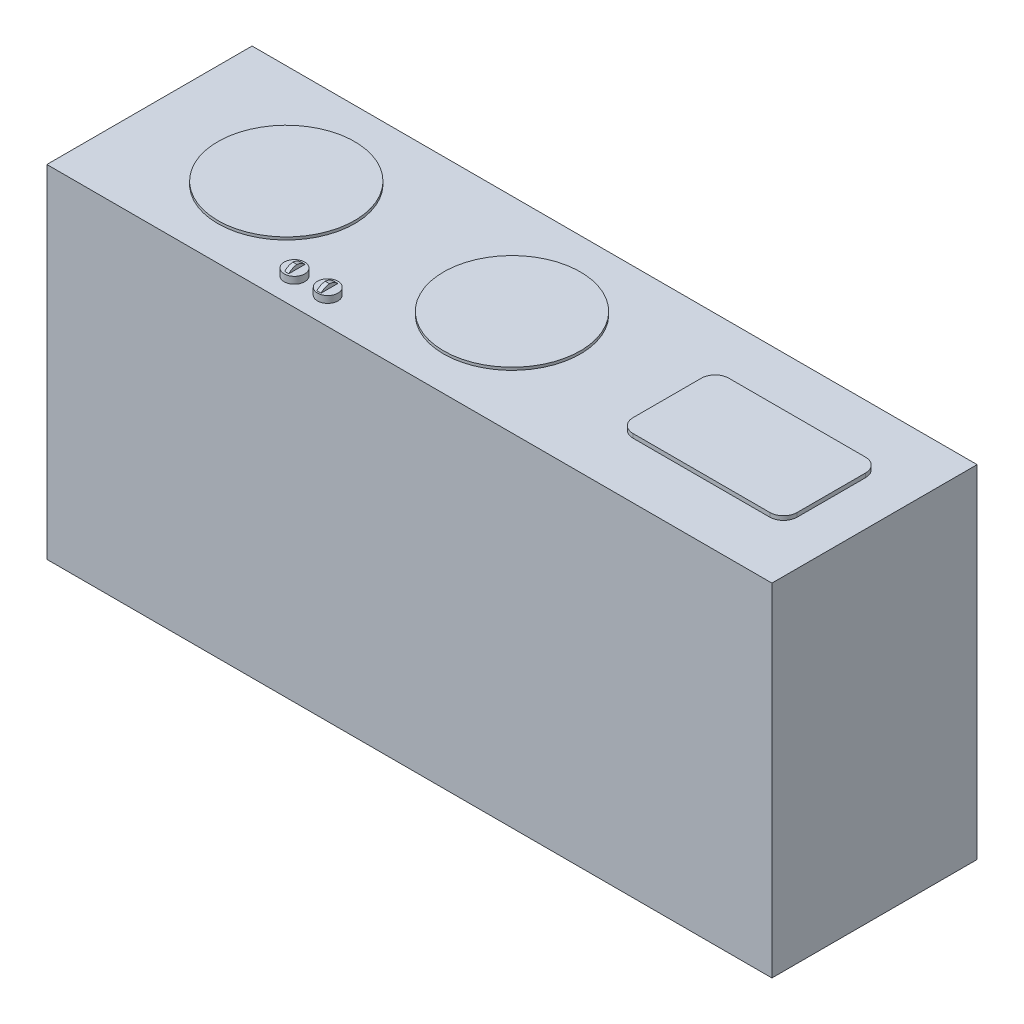
from build123d import *

# Parameters (mm, degrees)
SKETCH_1_W      = 53
SKETCH_1_H      = 15
EXTRUDE_1_DEPTH = 25
SKETCH_2_R      = 5
EXTRUDE_2_DEPTH = 0.2
SKETCH_3_R      = 0.75
EXTRUDE_4_DEPTH = 0.5
SKETCH_4_W      = 0.308010804
SKETCH_4_H      = 1.227700604
EXTRUDE_5_DEPTH = 0.3
SKETCH_6_W      = 0.300930155
SKETCH_6_H      = 1.191236652
EXTRUDE_8_DEPTH = 0.3
SKETCH_8_W      = 12
SKETCH_8_H      = 7
EXTRUDE_9_DEPTH = 0.3
FILLET_1_R      = 1
FILLET_2_R      = 1


with BuildPart() as part:
    # 草圖1 → 填料-伸長1 (new body)
    with BuildSketch(Plane(origin=(0, 0, 0), x_dir=(1, 0, 0), z_dir=(0, 1, 0))):
        Rectangle(SKETCH_1_W, SKETCH_1_H)
    extrude(amount=EXTRUDE_1_DEPTH)

    # 草圖2 → 填料-伸長2 (add)
    with BuildSketch(Plane(origin=(0, 25, 0), x_dir=(1, 0, 0), z_dir=(0, 1, 0))):
        with Locations(Location((0, 0, 0), (0, 0, 270))):
            Circle(SKETCH_2_R)
        with Locations(Location((-16.5, 0, 0), (0, 0, 270))):
            Circle(SKETCH_2_R)
    extrude(amount=EXTRUDE_2_DEPTH)

    # 草圖3 → 填料-伸長4 (add)
    with BuildSketch(Plane(origin=(0, 25, 0), x_dir=(1, 0, 0), z_dir=(0, 1, 0))):
        with Locations(Location((-7.968179653, -5.500848642, 0), (0, 0, 270))):
            Circle(SKETCH_3_R)
        with Locations(Location((-10.399702952, -5.500848642, 0), (0, 0, 270))):
            Circle(SKETCH_3_R)
    extrude(amount=EXTRUDE_4_DEPTH)

    # 草圖4 → 填料-伸長5 (add)
    with BuildSketch(Plane(origin=(0, 25.5, 0), x_dir=(1, 0, 0), z_dir=(0, 1, 0))):
        with Locations((-7.986543435, -5.513019863)):
            Rectangle(SKETCH_4_W, SKETCH_4_H)
    extrude(amount=EXTRUDE_5_DEPTH)

    # 草圖6 → 填料-伸長8 (add)
    with BuildSketch(Plane(origin=(0, 25.5, 0), x_dir=(1, 0, 0), z_dir=(0, 1, 0))):
        with Locations((-10.389863122, -5.481431278)):
            Rectangle(SKETCH_6_W, SKETCH_6_H)
    extrude(amount=EXTRUDE_8_DEPTH)

    # 草圖8 → 填料-伸長9 (add)
    with BuildSketch(Plane(origin=(0, 25, 0), x_dir=(1, 0, 0), z_dir=(0, 1, 0))):
        with Locations((17.250728111, 0.094744835)):
            Rectangle(SKETCH_8_W, SKETCH_8_H)
    extrude(amount=EXTRUDE_9_DEPTH)

    # 圓角1
    fillet_1_edges = [part.edges().sort_by_distance(p)[0] for p in [
        (23.250728111, 25.15, 3.405255165),
        (23.250728111, 25.15, -3.594744835),
        (11.250728111, 25.15, -3.594744835),
        (11.250728111, 25.15, 3.405255165),
    ]]
    fillet(fillet_1_edges, radius=FILLET_1_R)

    # 圓角2
    # the kernel refuses this fillet: 1 mm, written as the material it takes off along each edge
    with BuildSketch(Plane(origin=(-8.454040937, 25.8, 4.885812952), x_dir=(0, -1, 0), z_dir=(-1, 0, 0)), Plane(origin=(-12.325685306, 25.8, 6.077049604), x_dir=(0, -1, 0), z_dir=(1, 0, 0))) as fillet_2_piece_1:
        with BuildLine():
            CenterArc((1, 0.714142843), FILLET_2_R, 180, 45.572995999)
            Line((0, 0.714142843), (-0.02, 0.714142843))
            Line((-0.02, 0.714142843), (-0.02, 0))
            Line((-0.02, 0), (0, -0.02))
            ThreePointArc((0, -0.02), (0.15, -0.02), (0.286, -0.014282857))
            Line((0.286, -0.014282857), (0.3, 0))
        make_face()
    extrude(amount=3.871644369, mode=Mode.SUBTRACT)
    with BuildSketch(Plane(origin=(-9.925905944, 25.8, 6.126870165), x_dir=(0, -1, 0), z_dir=(1, 0, 0)), Plane(origin=(-6.047180926, 25.8, 4.899169561), x_dir=(0, -1, 0), z_dir=(-1, 0, 0))) as fillet_2_piece_2:
        with BuildLine():
            CenterArc((1, 0.714142843), FILLET_2_R, 180, 45.572995999)
            Line((0, 0.714142843), (-0.02, 0.714142843))
            Line((-0.02, 0.714142843), (-0.02, 0))
            Line((-0.02, 0), (0, -0.02))
            ThreePointArc((0, -0.02), (0.15, -0.02), (0.286, -0.014282857))
            Line((0.286, -0.014282857), (0.3, 0))
        make_face()
    extrude(amount=3.878725018, mode=Mode.SUBTRACT)


solid = part.part
